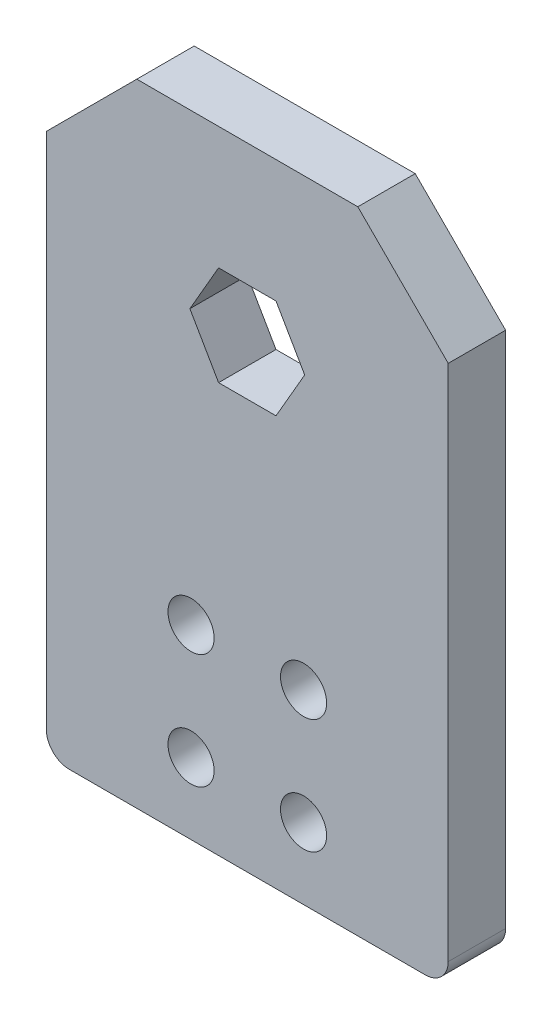
from build123d import *

# Parameters (mm, degrees)
SKETCH1_W                      = 44.45
SKETCH1_H                      = 69.85
BOSS_EXTRUDE1_DEPTH            = 3.175
CHAMFER1_SIZE                  = 10
CUT_EXTRUDE1_DEPTH             = 42.881126418
TAP_DRILL_FOR_10_24_TAP1_D     = 3.7973
TAP_DRILL_FOR_10_24_TAP1_DEPTH = 19.05
TAP_DRILL_FOR_10_24_TAP1_TIP   = 1.140824014
F_10_CLEARANCE_HOLE1_D         = 5.1054
F_10_CLEARANCE_HOLE1_DEPTH     = 12.7
F_10_CLEARANCE_HOLE1_TIP       = 1.533816902
FILLET1_R                      = 2.54


with BuildPart() as part:
    # Sketch1 → Boss-Extrude1 (new, symmetric)
    with BuildSketch(Plane.XY):
        Rectangle(SKETCH1_W, SKETCH1_H)
    extrude(amount=BOSS_EXTRUDE1_DEPTH, both=True)

    # Chamfer1
    chamfer1_edges = [part.edges().sort_by_distance(p)[0] for p in [
        (22.225, 34.925, 0),
        (-22.225, 34.925, 0),
    ]]
    chamfer(chamfer1_edges, length=CHAMFER1_SIZE)

    # Sketch2 → Cut-Extrude1 (cut, through all)
    with BuildSketch(Plane.XY.offset(3.175)):
        Polygon((6.35, 15.875), (3.175, 21.374261314), (-3.175, 21.374261314), (-6.35, 15.875), (-3.175, 10.375738686), (3.175, 10.375738686), align=None)
    extrude(amount=-CUT_EXTRUDE1_DEPTH, mode=Mode.SUBTRACT)

    # Tap Drill for #10-24 Tap1
    with Locations(Plane(origin=(0, -34.925, 0), x_dir=(-1, 0, 0), z_dir=(0, -1, 0))):
        with Locations((15.875, 0), (-15.875, 0)):
            Hole(TAP_DRILL_FOR_10_24_TAP1_D / 2, depth=TAP_DRILL_FOR_10_24_TAP1_DEPTH)
            with Locations((0, 0, -(TAP_DRILL_FOR_10_24_TAP1_DEPTH + TAP_DRILL_FOR_10_24_TAP1_TIP / 2))):  # 118° drill point
                Cone(0, TAP_DRILL_FOR_10_24_TAP1_D / 2, TAP_DRILL_FOR_10_24_TAP1_TIP, mode=Mode.SUBTRACT)

    # #10 Clearance Hole1
    with Locations(Plane.XY.offset(3.175)):
        with Locations((-6.223, -14.351), (6.223, -14.351), (6.223, -27.051), (-6.223, -27.051)):
            Hole(F_10_CLEARANCE_HOLE1_D / 2, depth=F_10_CLEARANCE_HOLE1_DEPTH)
            with Locations((0, 0, -(F_10_CLEARANCE_HOLE1_DEPTH + F_10_CLEARANCE_HOLE1_TIP / 2))):  # 118° drill point
                Cone(0, F_10_CLEARANCE_HOLE1_D / 2, F_10_CLEARANCE_HOLE1_TIP, mode=Mode.SUBTRACT)

    # Fillet1
    fillet1_edges = [part.edges().sort_by_distance(p)[0] for p in [
        (22.225, -34.925, 0),
        (-22.225, -34.925, 0),
    ]]
    fillet(fillet1_edges, radius=FILLET1_R)


solid = part.part
